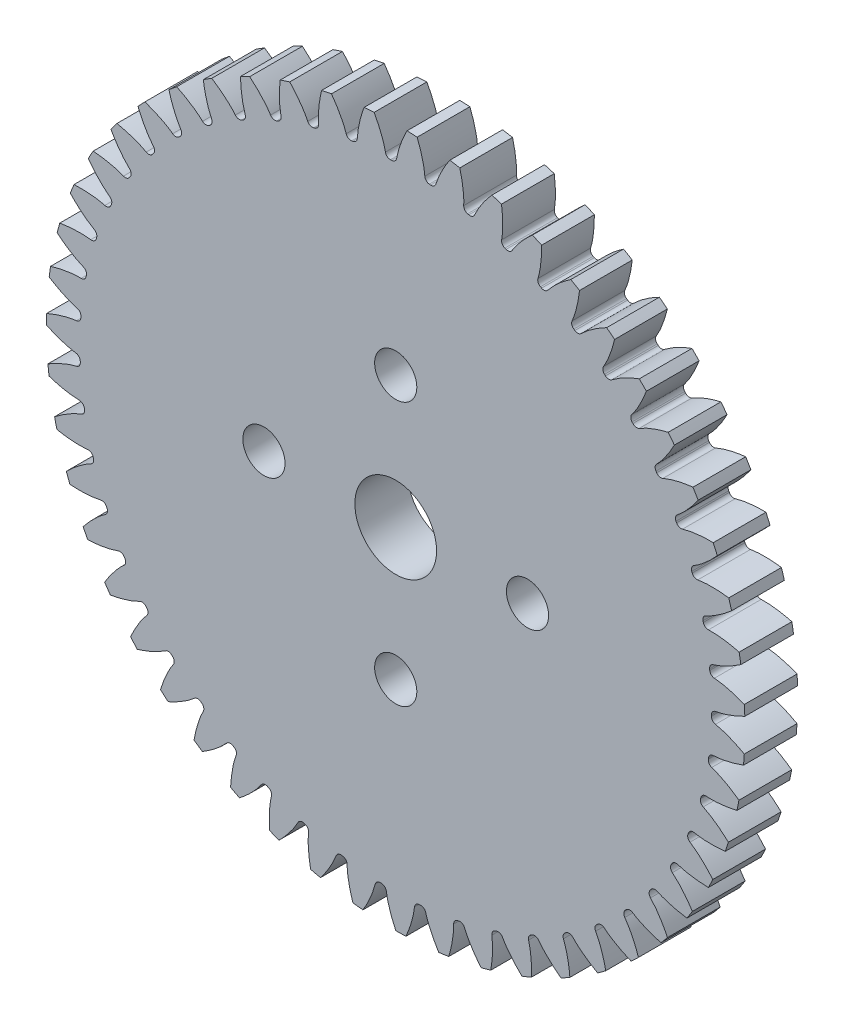
from build123d import *

# Parameters (mm, degrees)
SKETCH_3_R                       = 26.5
EXTRUDE_1_DEPTH                  = 4
CUT_EXTRUDE_1_DEPTH              = 38.68952109
FILLET_1_R                       = 0.38
PATTERN_CIRCULAR_1_COUNT         = 51
FILLET_1_OF_PATTERN_CIRCULAR_1_R = 0.38
SKETCH_5_R                       = 3.1
SKETCH_5_R_2                     = 1.6
CUT_EXTRUDE_2_DEPTH              = 38.689496667
PATTERN_CIRCULAR_2_COUNT         = 4


with BuildPart() as part:
    # 草圖3 → 填料-伸長1 (new body)
    with BuildSketch(Plane.XY):
        Circle(SKETCH_3_R)
    extrude(amount=EXTRUDE_1_DEPTH)

    # 草圖4 → 除料-伸長1 (cut, through all)
    with BuildSketch(Plane.XY.offset(4)):
        with BuildLine():
            Line((23.949777459, -0.770298155), (23.947616746, -0.77022866))
            ThreePointArc((23.947616746, -0.77022866), (23.956903986, -0.385164099), (23.96, 0))
            Line((23.96, 0), (23.96216183, 0))
            add(Edge.make_bspline(
                [(23.96216183, 0), (23.973089521, 0.000181594), (24.003726642, 0.001253167), (24.061581477, 0.005498874), (24.155785273, 0.015574555), (24.275440198, 0.033030698), (24.429511563, 0.060879588), (24.610116106, 0.100462101), (24.807476358, 0.151030185), (25.020801418, 0.213631857), (25.232247446, 0.282761346), (25.441759696, 0.35789582), (25.649103658, 0.43828816), (25.898510524, 0.542173937), (26.133825186, 0.648181859), (26.316626148, 0.736451215), (26.448020935, 0.802727215), (26.487224801, 0.822752893)],
                knots=[0, 0, 0, 0, 0, 0.005376749, 0.015083688, 0.02853182, 0.046610139, 0.064854849, 0.092110525, 0.119476176, 0.146842496, 0.174208854, 0.201574956, 0.228941013, 0.256307345, 0.307035032, 0.328695728, 0.328695728, 0.328695728, 0.328695728, 0.328695728], degree=4))
            ThreePointArc((26.487224801, 0.822752893), (26.496575778, -0.425995352), (26.447086826, -1.673797605))
            add(Edge.make_bspline(
                [(23.949777459, -0.770298155), (23.960693664, -0.770830942), (23.991280504, -0.772886835), (24.048968954, -0.778990174), (24.142800164, -0.792088965), (24.261832095, -0.813382565), (24.414928589, -0.846169908), (24.594167353, -0.891537756), (24.78980002, -0.948424134), (25.001002406, -1.017851093), (25.210116885, -1.09374209), (25.417105548, -1.175572805), (25.62175802, -1.262588966), (25.867696428, -1.374438594), (26.099481695, -1.487956256), (26.279350635, -1.582056391), (26.408546976, -1.652522012), (26.447086826, -1.673797605)],
                knots=[0, 0, 0, 0, 0, 0.005376749, 0.015083688, 0.02853182, 0.046610139, 0.064854849, 0.092110525, 0.119476176, 0.146842496, 0.174208854, 0.201574956, 0.228941013, 0.256307345, 0.307035032, 0.328695728, 0.328695728, 0.328695728, 0.328695728, 0.328695728], degree=4))
        make_face()
    cut_extrude_1 = extrude(amount=-CUT_EXTRUDE_1_DEPTH, mode=Mode.SUBTRACT)

    # 圓角1
    fillet_1_edges = [part.edges().sort_by_distance(p)[0] for p in [
        (23.947616746, -0.77022866, 2),
        (23.96, 0, 2),
    ]]
    fillet(fillet_1_edges, radius=FILLET_1_R)

    # 環狀複製排列1: 除料-伸長1 ×51 about axis
    pattern_circular_1_axis = Axis((0, 0, 4), (0, 0, 1))
    for i in range(1, PATTERN_CIRCULAR_1_COUNT):
        add(cut_extrude_1.rotate(pattern_circular_1_axis, i * 360 / PATTERN_CIRCULAR_1_COUNT), mode=Mode.SUBTRACT)

    # 圓角1 of 環狀複製排列1
    fillet_1_of_pattern_circular_1_edges = [part.edges().sort_by_distance(p)[0] for p in [
        (23.8607581, 2.178490968, 2),
        (23.778395412, 2.944403444, 2),
        (23.412194683, 5.094186894, 2),
        (23.236334587, 5.844172734, 2),
        (22.60872626, 7.932660139, 2),
        (22.342034617, 8.655350322, 2),
        (21.462532594, 10.650882342, 2),
        (21.109052175, 11.335321622, 2),
        (19.99098881, 13.207648027, 2),
        (19.55607802, 13.843461001, 2),
        (18.216402014, 15.56419923, 2),
        (17.706653657, 16.141747622, 2),
        (16.165673132, 17.684813038, 2),
        (15.588814473, 18.195341803, 2),
        (13.869889124, 19.537343107, 2),
        (13.234664752, 19.97311315, 2),
        (11.363851735, 21.09370697, 2),
        (10.679891004, 21.448112461, 2),
        (8.685549938, 22.330311737, 2),
        (7.963220996, 22.59798025, 2),
        (5.875584056, 23.228411741, 2),
        (5.125836674, 23.405285694, 2),
        (2.97655031, 23.7743927, 2),
        (2.210749893, 23.857790864, 2),
        (0.032395096, 23.9599781, 2),
        (-0.737849603, 23.948636244, 2),
        (-2.912251196, 23.782354656, 2),
        (-3.675264051, 23.676444711, 2),
        (-5.812750728, 23.244214957, 2),
        (-6.556965242, 23.04534241, 2),
        (-8.625134884, 22.353716654, 2),
        (-9.339269524, 22.06489621, 2),
        (-11.306770787, 21.124358792, 2),
        (-11.98, 20.749968675, 2),
        (-13.81700757, 19.574777184, 2),
        (-14.439125888, 19.120492766, 2),
        (-16.117792603, 17.728461907, 2),
        (-16.679369345, 17.201169677, 2),
        (-18.17424833, 15.613401219, 2),
        (-18.666770566, 15.021094389, 2),
        (-19.955200978, 13.261657284, 2),
        (-20.371202572, 12.613314623, 2),
        (-21.43365312, 10.708880143, 2),
        (-21.766827913, 10.014329863, 2),
        (-22.587192929, 7.993767295, 2),
        (-22.83249033, 7.263538072, 2),
        (-23.398333918, 5.157477083, 2),
        (-23.552035468, 4.402638447, 2),
        (-23.854780015, 2.243004776, 2),
        (-23.914555757, 1.474999311, 2),
        (-23.949611964, -0.705469197, 2),
        (-23.914555757, -1.474999311, 2),
        (-23.681392208, -3.643248977, 2),
        (-23.552035468, -4.402638447, 2),
        (-23.054186685, -6.525800815, 2),
        (-22.83249033, -7.263538072, 2),
        (-22.077503193, -9.309428166, 2),
        (-21.766827913, -10.014329863, 2),
        (-20.766147257, -11.951934074, 2),
        (-20.371202572, -12.613314623, 2),
        (-19.139997696, -14.413260846, 2),
        (-18.666770566, -15.021094389, 2),
        (-17.22370528, -16.656097275, 2),
        (-16.679369345, -17.201169677, 2),
        (-15.046319049, -18.646444247, 2),
        (-14.439125888, -19.120492766, 2),
        (-12.640845959, -20.354130132, 2),
        (-11.98, -20.749968675, 2),
        (-10.043750529, -21.753268152, 2),
        (-9.339269524, -22.06489621, 2),
        (-7.29440208, -22.822648801, 2),
        (-6.556965242, -23.04534241, 2),
        (-4.43447793, -23.546061358, 2),
        (-3.675264051, -23.676444711, 2),
        (-1.507331615, -23.912539627, 2),
        (-0.737849603, -23.948636244, 2),
        (1.44266431, -23.91652817, 2),
        (2.210749893, -23.857790864, 2),
        (4.370790915, -23.557966525, 2),
        (5.125836674, -23.405285694, 2),
        (7.232660786, -22.842290121, 2),
        (7.963220996, -22.59798025, 2),
        (9.984890891, -21.780347883, 2),
        (10.679891004, -21.448112461, 2),
        (12.585760228, -20.388237773, 2),
        (13.234664752, -19.97311315, 2),
        (14.99584227, -18.68706276, 2),
        (15.588814473, -18.195341803, 2),
        (17.178602629, -16.702610925, 2),
        (17.706653657, -16.141747622, 2),
        (19.100952883, -14.464964534, 2),
        (19.55607802, -13.843461001, 2),
        (20.733752161, -12.008044026, 2),
        (21.109052175, -11.335321622, 2),
        (22.052248892, -9.36909381, 2),
        (22.342034617, -8.655350322, 2),
        (23.036456008, -6.588117683, 2),
        (23.236334587, -5.844172734, 2),
        (23.671453933, -3.707272406, 2),
        (23.778395412, -2.944403444, 2),
    ]]
    fillet(fillet_1_of_pattern_circular_1_edges, radius=FILLET_1_OF_PATTERN_CIRCULAR_1_R)

    # 草圖5 → 除料-伸長2 (cut, through all)
    with BuildSketch(Plane.XY.offset(4)):
        Circle(SKETCH_5_R)
        with Locations((10, 0)):
            Circle(SKETCH_5_R_2)
    cut_extrude_2 = extrude(amount=-CUT_EXTRUDE_2_DEPTH, mode=Mode.SUBTRACT)

    # 環狀複製排列2: 除料-伸長2 ×4 about axis
    pattern_circular_2_axis = Axis((0, 0, 4), (0, 0, 1))
    for i in range(1, PATTERN_CIRCULAR_2_COUNT):
        add(cut_extrude_2.rotate(pattern_circular_2_axis, i * 360 / PATTERN_CIRCULAR_2_COUNT), mode=Mode.SUBTRACT)


solid = part.part
